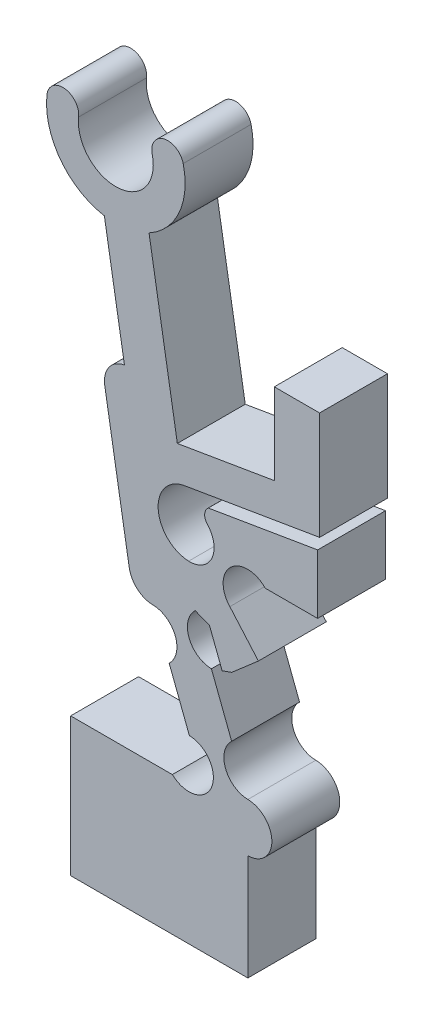
from build123d import *

# Parameters (mm, degrees)
BOSS_EXTRUDE1_DEPTH = 3


with BuildPart() as part:
    # Sketch-SwitchBossUp → Boss-Extrude1 (new body)
    with BuildSketch(Plane.XY):
        with BuildLine():
            Line((7.040476927, 18.423363555), (7.040476927, 22.010599905))
            Line((7.040476927, 22.010599905), (9.040476927, 22.010599905))
            Line((9.040476927, 22.010599905), (9.040476927, 17.250255172))
            Line((9.040476927, 17.250255172), (3.004792013, 16.234206078))
            ThreePointArc((3.004792013, 16.234206078), (1.91350778, 14.731674863), (3.25659329, 13.449246446))
            ThreePointArc((3.25659329, 13.449246446), (4.285298124, 14.079636296), (4.085366752, 15.269448233))
            ThreePointArc((4.085366752, 15.269448233), (3.964420702, 15.601175386), (4.124835475, 15.915719424))
            Line((4.124835475, 15.915719424), (8.955734017, 16.728954401))
            Line((8.955734017, 16.728954401), (8.955734017, 14.106479546))
            Line((8.955734017, 14.106479546), (6.639548057, 14.106479546))
            ThreePointArc((6.639548057, 14.106479546), (6.304980223, 14.344784127), (5.90556854, 14.440674771))
            ThreePointArc((5.90556854, 14.440674771), (4.876863705, 13.810284921), (5.076795077, 12.620472983))
            Line((5.076795077, 12.620472983), (6.338018038, 11.169601935))
            Line((6.338018038, 11.169601935), (5.159547033, 10.14517272))
            Line((5.159547033, 10.14517272), (4.737113771, 9.995064824))
            Line((4.737113771, 9.995064824), (4.177937256, 11.451465286))
            Line((4.177937256, 11.451465286), (3.546393548, 11.701389219))
            ThreePointArc((3.546393548, 11.701389219), (3.274676841, 10.525891439), (4.263259905, 9.834278449))
            Line((4.263259905, 9.834278449), (5.156260325, 7.508418563))
            ThreePointArc((5.156260325, 7.508418563), (4.884543619, 6.332920783), (5.873126682, 5.641307794))
            ThreePointArc((5.873126682, 5.641307794), (6.933353036, 4.563217548), (5.873126682, 3.485127303))
            Line((5.873126682, 3.485127303), (5.873126682, -1.189543551))
            Line((5.873126682, -1.189543551), (-1.954752854, -1.189543551))
            Line((-1.954752854, -1.189543551), (-1.954752854, 4.924441437))
            Line((-1.954752854, 4.924441437), (2.536254426, 4.924441437))
            ThreePointArc((2.536254426, 4.924441437), (3.271135169, 4.635221221), (4.006015912, 4.924441437))
            ThreePointArc((4.006015912, 4.924441437), (4.277732619, 6.099939217), (3.289149555, 6.791552207))
            Line((3.289149555, 6.791552207), (2.396149135, 9.117412093))
            ThreePointArc((2.396149135, 9.117412093), (2.667865841, 10.292909873), (1.679282778, 10.984522862))
            ThreePointArc((1.679282778, 10.984522862), (0.990609652, 11.24824473), (0.632497087, 11.892896022))
            Line((0.632497087, 11.892896022), (-0.448028681, 18.3115948))
            ThreePointArc((-0.448028681, 18.3115948), (-0.266285833, 19.102309392), (0.421345416, 19.532917442))
            Line((0.421345416, 19.532917442), (-0.465233701, 24.799505683))
            ThreePointArc((-0.465233701, 24.799505683), (-2.406587703, 25.978955839), (-3.001107523, 28.171329943))
            ThreePointArc((-3.001107523, 28.171329943), (-2.220760115, 28.789797628), (-1.602292431, 28.009450221))
            ThreePointArc((-1.602292431, 28.009450221), (0.141134159, 26.168671513), (1.647974165, 28.207650602))
            ThreePointArc((1.647974165, 28.207650602), (2.167041147, 29.057364566), (3.016755111, 28.538297585))
            ThreePointArc((3.016755111, 28.538297585), (2.839798095, 26.578800421), (1.507016259, 25.131514861))
            Line((1.507016259, 25.131514861), (2.757637631, 17.702389044))
            Line((2.757637631, 17.702389044), (7.040476927, 18.423363555))
        make_face()
    extrude(amount=BOSS_EXTRUDE1_DEPTH)


solid = part.part
